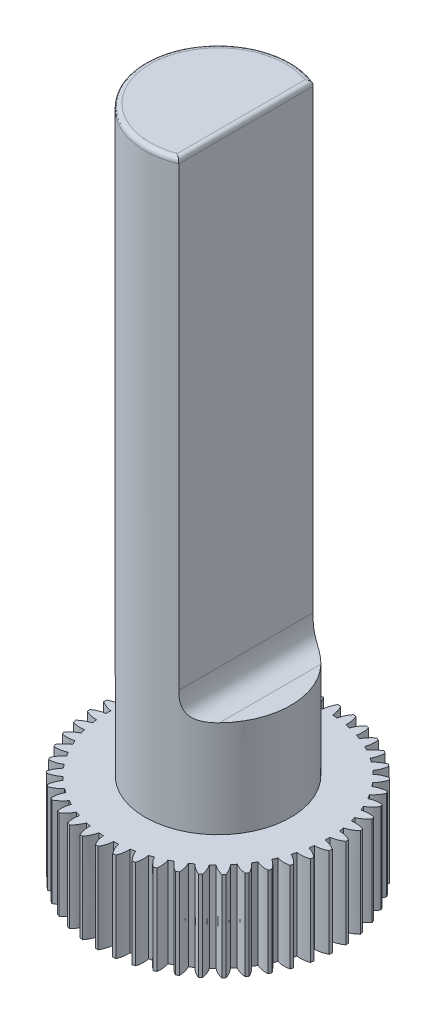
from build123d import *

# Parameters (mm, degrees)
SKETCH1_R           = 1.5
BOSS_EXTRUDE1_DEPTH = 12
CUT_EXTRUDE1_START  = -10
CUT_EXTRUDE1_DEPTH  = 10
FILLET2_SIZE        = 0.5
FILLET3_SIZE        = 0.1
SKETCH3_R           = 2.26
BOSS_EXTRUDE2_DEPTH = 1.85
BOSS_EXTRUDE3_DEPTH = 1.85
SKETCH5_R           = 0.5
CUT_EXTRUDE2_DEPTH  = 1


with BuildPart() as part:
    # Sketch1 → Boss-Extrude1 (new body)
    with BuildSketch(Plane(origin=(0, 0, 0), x_dir=(1, 0, 0), z_dir=(0, 1, 0))):
        with Locations(Location((0, 0, 0), (0, 0, 270))):
            Circle(SKETCH1_R)
    extrude(amount=BOSS_EXTRUDE1_DEPTH)

    # Sketch2 → Cut-Extrude1 (cut)
    with BuildSketch(Plane(origin=(0, 12, 0), x_dir=(1, 0, 0), z_dir=(0, 1, 0)).offset(CUT_EXTRUDE1_START)):
        with BuildLine():
            Line((0.575999132, 1.385), (0.575999132, -1.385))
            ThreePointArc((0.575999132, -1.385), (1.5, 0), (0.575999132, 1.385))
        make_face()
    extrude(amount=CUT_EXTRUDE1_DEPTH, mode=Mode.SUBTRACT)

    # Fillet2
    # a fillet whose section is not a circle: 0.5 mm, written as the material it adds along each edge
    with BuildSketch(Plane(origin=(0.575999132, 2, -2.635), x_dir=(0, 1, 0), z_dir=(0, 0, 1))) as fillet2_piece_1_section:
        with BuildLine():
            add(Edge.make_bspline([(FILLET2_SIZE, 0), (FILLET2_SIZE * 0.831801948466, 0), (FILLET2_SIZE * 0.663603896932, 0), (FILLET2_SIZE * 0.292893218813, -FILLET2_SIZE * 0.0716919198361), (FILLET2_SIZE * 0.0716919198361, -FILLET2_SIZE * 0.292893218813), (0, -FILLET2_SIZE * 0.663603896932), (0, -FILLET2_SIZE * 0.831801948466), (0, -FILLET2_SIZE)], knots=[0, 0, 0, 0, 0, 0, 0.5, 0.5, 1, 1, 1, 1, 1, 1], degree=5))
            Line((0, -FILLET2_SIZE), (-FILLET2_SIZE * 0.02, -FILLET2_SIZE))
            Line((-FILLET2_SIZE * 0.02, -FILLET2_SIZE), (-FILLET2_SIZE * 0.02, FILLET2_SIZE * 0.02))
            Line((-FILLET2_SIZE * 0.02, FILLET2_SIZE * 0.02), (FILLET2_SIZE, FILLET2_SIZE * 0.02))
            Line((FILLET2_SIZE, FILLET2_SIZE * 0.02), (FILLET2_SIZE, 0))
        make_face()
    fillet2_piece_1 = extrude(amount=5.27, mode=Mode.PRIVATE)
    fillet2_piece_1 = fillet2_piece_1 & Plane(origin=(0, 2, 0), x_dir=(0, 0, 1), z_dir=(0, -1, 0)) * Cylinder(1.5, 13, mode=Mode.PRIVATE)
    add(fillet2_piece_1)

    # Fillet3
    # a fillet whose section is not a circle: 0.1 mm, written as the material it takes off along each edge
    with BuildSketch(Plane(origin=(0, 12, 0), x_dir=(0.5321434163094132, 0, -0.8466542295875846), z_dir=(0.8466542295875846, 0, 0.5321434163094132))) as fillet3_piece_1:
        with BuildLine():
            add(Edge.make_bspline([(1.5, -FILLET3_SIZE), (1.5, -FILLET3_SIZE * 0.831801948466), (1.5, -FILLET3_SIZE * 0.663603896932), (1.5 - FILLET3_SIZE * 0.0716919198361, -FILLET3_SIZE * 0.292893218813), (1.5 - FILLET3_SIZE * 0.292893218813, -FILLET3_SIZE * 0.0716919198361), (1.5 - FILLET3_SIZE * 0.663603896932, 0), (1.5 - FILLET3_SIZE * 0.831801948466, 0), (1.5 - FILLET3_SIZE, 0)], knots=[0, 0, 0, 0, 0, 0, 0.5, 0.5, 1, 1, 1, 1, 1, 1], degree=5))
            Line((1.5 - FILLET3_SIZE, 0), (1.5, 0))
            Line((1.5, 0), (1.5, -FILLET3_SIZE))
        make_face()
    revolve(axis=Axis((0, 12, 0), (0, 1, 0)), revolution_arc=212.150391549, mode=Mode.SUBTRACT)
    with BuildSketch(Plane(origin=(0.575999132, 12, -1.635), x_dir=(0, -1, 0), z_dir=(0, 0, 1))) as fillet3_piece_2:
        with BuildLine():
            add(Edge.make_bspline([(FILLET3_SIZE, 0), (FILLET3_SIZE * 0.831801948466, 0), (FILLET3_SIZE * 0.663603896932, 0), (FILLET3_SIZE * 0.292893218813, -FILLET3_SIZE * 0.0716919198361), (FILLET3_SIZE * 0.0716919198361, -FILLET3_SIZE * 0.292893218813), (0, -FILLET3_SIZE * 0.663603896932), (0, -FILLET3_SIZE * 0.831801948466), (0, -FILLET3_SIZE)], knots=[0, 0, 0, 0, 0, 0, 0.5, 0.5, 1, 1, 1, 1, 1, 1], degree=5))
            Line((0, -FILLET3_SIZE), (0, 0))
            Line((0, 0), (FILLET3_SIZE, 0))
        make_face()
    extrude(amount=3.27, mode=Mode.SUBTRACT)
    with BuildSketch(Plane(origin=(0, 12, 0), x_dir=(0, 0, 1), z_dir=(-1, 0, 0))) as fillet3_piece_3:
        with BuildLine():
            add(Edge.make_bspline([(1.5, -FILLET3_SIZE), (1.5, -FILLET3_SIZE * 0.831801948466), (1.5, -FILLET3_SIZE * 0.663603896932), (1.5 - FILLET3_SIZE * 0.0716919198361, -FILLET3_SIZE * 0.292893218813), (1.5 - FILLET3_SIZE * 0.292893218813, -FILLET3_SIZE * 0.0716919198361), (1.5 - FILLET3_SIZE * 0.663603896932, 0), (1.5 - FILLET3_SIZE * 0.831801948466, 0), (1.5 - FILLET3_SIZE, 0)], knots=[0, 0, 0, 0, 0, 0, 0.5, 0.5, 1, 1, 1, 1, 1, 1], degree=5))
            Line((1.5 - FILLET3_SIZE, 0), (1.5, 0))
            Line((1.5, 0), (1.5, -FILLET3_SIZE))
        make_face()
    revolve(axis=Axis((0, 12, 0), (0, 1, 0)), revolution_arc=32.131175169, mode=Mode.SUBTRACT)

    # Sketch3 → Boss-Extrude2 (add)
    with BuildSketch(Plane.XZ):
        with Locations(Location((0, 0, 0), (0, 0, 270))):
            Circle(SKETCH3_R)
    extrude(amount=BOSS_EXTRUDE2_DEPTH)

    # Sketch4 → Boss-Extrude3 (add)
    with BuildSketch(Plane.XZ.offset(1.85)):
        with BuildLine():
            Line((-0.03, 2.5), (0.03, 2.5))
            add(Edge.make_bspline(
                [(0.03, 2.5), (0.099840217, 2.379264551), (0.105, 2.249069746)],
                knots=[0, 0, 0, 0.862405798, 0.862405798, 0.862405798], degree=2))
            Line((0.105, 2.249069746), (0, 2.26))
            Line((0, 2.26), (-0.105, 2.249069746))
            add(Edge.make_bspline(
                [(-0.03, 2.5), (-0.099840217, 2.379264551), (-0.105, 2.249069746)],
                knots=[0, 0, 0, 0.862405798, 0.862405798, 0.862405798], degree=2))
        make_face()
        with BuildLine():
            Line((0.310696044, 2.480799865), (0.370137201, 2.472629866))
            add(Edge.make_bspline(
                [(0.370137201, 2.472629866), (0.422886781, 2.343509044), (0.410270315, 2.213824291)],
                knots=[0, 0, 0, 0.862405798, 0.862405798, 0.862405798], degree=2))
            Line((0.410270315, 2.213824291), (0.307736627, 2.238950238))
            Line((0.307736627, 2.238950238), (0.202226267, 2.242419287))
            add(Edge.make_bspline(
                [(0.310696044, 2.480799865), (0.225066181, 2.37069886), (0.202226267, 2.242419287)],
                knots=[0, 0, 0, 0.862405798, 0.862405798, 0.862405798], degree=2))
        make_face()
        with BuildLine():
            Line((0.645604409, 2.415387122), (0.703379447, 2.399199315))
            add(Edge.make_bspline(
                [(0.703379447, 2.399199315), (0.738055765, 2.264098399), (0.707898071, 2.137339478)],
                knots=[0, 0, 0, 0.862405798, 0.862405798, 0.862405798], degree=2))
            Line((0.707898071, 2.137339478), (0.609740703, 2.176193069))
            Line((0.609740703, 2.176193069), (0.50568544, 2.1939968))
            add(Edge.make_bspline(
                [(0.645604409, 2.415387122), (0.545780022, 2.317971535), (0.50568544, 2.1939968)],
                knots=[0, 0, 0, 0.862405798, 0.862405798, 0.862405798], degree=2))
        make_face()
        with BuildLine():
            Line((0.968486386, 2.304980286), (1.023519064, 2.281076221))
            add(Edge.make_bspline(
                [(1.023519064, 2.281076221), (1.039476166, 2.142511884), (0.992339025, 2.021040074)],
                knots=[0, 0, 0, 0.862405798, 0.862405798, 0.862405798], degree=2))
            Line((0.992339025, 2.021040074), (0.900386463, 2.072897541))
            Line((0.900386463, 2.072897541), (0.799724651, 2.104704303))
            add(Edge.make_bspline(
                [(0.968486386, 2.304980286), (0.856327014, 2.222064787), (0.799724651, 2.104704303)],
                knots=[0, 0, 0, 0.862405798, 0.862405798, 0.862405798], degree=2))
        make_face()
        with BuildLine():
            Line((1.273327293, 2.15163603), (1.324592457, 2.120460993))
            add(Edge.make_bspline(
                [(1.324592457, 2.120460993), (1.321533093, 1.981014426), (1.25829458, 1.867092518)],
                knots=[0, 0, 0, 0.862405798, 0.862405798, 0.862405798], degree=2))
            Line((1.25829458, 1.867092518), (1.174259727, 1.930987854))
            Line((1.174259727, 1.930987854), (1.078866505, 1.976205148))
            add(Edge.make_bspline(
                [(1.273327293, 2.15163603), (1.150922254, 2.084765175), (1.078866505, 1.976205148)],
                knots=[0, 0, 0, 0.862405798, 0.862405798, 0.862405798], degree=2))
        make_face()
        with BuildLine():
            Line((1.554448522, 1.958210865), (1.6009912, 1.920345588))
            add(Edge.make_bspline(
                [(1.6009912, 1.920345588), (1.578972358, 1.782614418), (1.500810488, 1.678364561)],
                knots=[0, 0, 0, 0.862405798, 0.862405798, 0.862405798], degree=2))
            Line((1.500810488, 1.678364561), (1.426258754, 1.753107517))
            Line((1.426258754, 1.753107517), (1.337911117, 1.81089303))
            add(Edge.make_bspline(
                [(1.554448522, 1.958210865), (1.42407799, 1.908630333), (1.337911117, 1.81089303)],
                knots=[0, 0, 0, 0.862405798, 0.862405798, 0.862405798], degree=2))
        make_face()
        with BuildLine():
            Line((1.806613316, 1.728307937), (1.847566505, 1.684457779))
            add(Edge.make_bspline(
                [(1.847566505, 1.684457779), (1.806998356, 1.551007676), (1.715369136, 1.458371848)],
                knots=[0, 0, 0, 0.862405798, 0.862405798, 0.862405798], degree=2))
            Line((1.715369136, 1.458371848), (1.651689279, 1.542570104))
            Line((1.651689279, 1.542570104), (1.572032976, 1.611847401))
            add(Edge.make_bspline(
                [(1.806613316, 1.728307937), (1.670705848, 1.696941319), (1.572032976, 1.611847401)],
                knots=[0, 0, 0, 0.862405798, 0.862405798, 0.862405798], degree=2))
        make_face()
        with BuildLine():
            Line((2.025124323, 1.466209902), (2.059725142, 1.417191708))
            add(Edge.make_bspline(
                [(2.059725142, 1.417191708), (2.001363394, 1.290508596), (1.897973703, 1.211212427)],
                knots=[0, 0, 0, 0.862405798, 0.862405798, 0.862405798], degree=2))
            Line((1.897973703, 1.211212427), (1.846351958, 1.303297528))
            Line((1.846351958, 1.303297528), (1.776870836, 1.382776104))
            add(Edge.make_bspline(
                [(2.025124323, 1.466209902), (1.886211617, 1.453641499), (1.776870836, 1.382776104)],
                knots=[0, 0, 0, 0.862405798, 0.862405798, 0.862405798], degree=2))
        make_face()
        with BuildLine():
            Line((2.205911095, 1.176799151), (2.233514997, 1.123526038))
            add(Edge.make_bspline(
                [(2.233514997, 1.123526038), (2.158446819, 1.005969782), (2.045222611, 0.94149041)],
                knots=[0, 0, 0, 0.862405798, 0.862405798, 0.862405798], degree=2))
            Line((2.045222611, 0.94149041), (2.006620594, 1.039746985))
            Line((2.006620594, 1.039746985), (1.948608954, 1.127946305))
            add(Edge.make_bspline(
                [(2.205911095, 1.176799151), (2.066580832, 1.183263089), (1.948608954, 1.127946305)],
                knots=[0, 0, 0, 0.862405798, 0.862405798, 0.862405798], degree=2))
        make_face()
        with BuildLine():
            Line((2.345605917, 0.865466858), (2.365698694, 0.808931203))
            add(Edge.make_bspline(
                [(2.365698694, 0.808931203), (2.275322463, 0.702691655), (2.154372892, 0.654230207)],
                knots=[0, 0, 0, 0.862405798, 0.862405798, 0.862405798], degree=2))
            Line((2.154372892, 0.654230207), (2.129509684, 0.756827924))
            Line((2.129509684, 0.756827924), (2.084048173, 0.852105001))
            add(Edge.make_bspline(
                [(2.345605917, 0.865466858), (2.208453556, 0.890842725), (2.084048173, 0.852105001)],
                knots=[0, 0, 0, 0.862405798, 0.862405798, 0.862405798], degree=2))
        make_face()
        with BuildLine():
            Line((2.441606539, 0.538012555), (2.4538139, 0.47926751))
            add(Edge.make_bspline(
                [(2.4538139, 0.47926751), (2.349813155, 0.386323711), (2.223391282, 0.354782934)],
                knots=[0, 0, 0, 0.862405798, 0.862405798, 0.862405798], degree=2))
            Line((2.223391282, 0.354782934), (2.212730038, 0.459810589))
            Line((2.212730038, 0.459810589), (2.180665519, 0.560390593))
            add(Edge.make_bspline(
                [(2.441606539, 0.538012555), (2.309186969, 0.581827648), (2.180665519, 0.560390593)],
                knots=[0, 0, 0, 0.862405798, 0.862405798, 0.862405798], degree=2))
        make_face()
        with BuildLine():
            Line((2.492124651, 0.200536096), (2.496219195, 0.14067597))
            add(Edge.make_bspline(
                [(2.496219195, 0.14067597), (2.380531273, 0.062759288), (2.250992099, 0.048726727)],
                knots=[0, 0, 0, 0.862405798, 0.862405798, 0.862405798], degree=2))
            Line((2.250992099, 0.048726727), (2.254731418, 0.154227854))
            Line((2.254731418, 0.154227854), (2.236661192, 0.258237168))
            add(Edge.make_bspline(
                [(2.492124651, 0.200536096), (2.366904599, 0.261974222), (2.236661192, 0.258237168)],
                knots=[0, 0, 0, 0.862405798, 0.862405798, 0.862405798], degree=2))
        make_face()
        with BuildLine():
            Line((2.496219195, -0.14067597), (2.492124651, -0.200536096))
            add(Edge.make_bspline(
                [(2.492124651, -0.200536096), (2.366904599, -0.261974222), (2.236661192, -0.258237168)],
                knots=[0, 0, 0, 0.862405798, 0.862405798, 0.862405798], degree=2))
            Line((2.236661192, -0.258237168), (2.254731418, -0.154227854))
            Line((2.254731418, -0.154227854), (2.250992099, -0.048726727))
            add(Edge.make_bspline(
                [(2.496219195, -0.14067597), (2.380531273, -0.062759288), (2.250992099, -0.048726727)],
                knots=[0, 0, 0, 0.862405798, 0.862405798, 0.862405798], degree=2))
        make_face()
        with BuildLine():
            Line((2.4538139, -0.47926751), (2.441606539, -0.538012555))
            add(Edge.make_bspline(
                [(2.441606539, -0.538012555), (2.309186969, -0.581827648), (2.180665519, -0.560390593)],
                knots=[0, 0, 0, 0.862405798, 0.862405798, 0.862405798], degree=2))
            Line((2.180665519, -0.560390593), (2.212730038, -0.459810589))
            Line((2.212730038, -0.459810589), (2.223391282, -0.354782934))
            add(Edge.make_bspline(
                [(2.4538139, -0.47926751), (2.349813155, -0.386323711), (2.223391282, -0.354782934)],
                knots=[0, 0, 0, 0.862405798, 0.862405798, 0.862405798], degree=2))
        make_face()
        with BuildLine():
            Line((2.365698694, -0.808931203), (2.345605917, -0.865466858))
            add(Edge.make_bspline(
                [(2.345605917, -0.865466858), (2.208453556, -0.890842725), (2.084048173, -0.852105001)],
                knots=[0, 0, 0, 0.862405798, 0.862405798, 0.862405798], degree=2))
            Line((2.084048173, -0.852105001), (2.129509684, -0.756827924))
            Line((2.129509684, -0.756827924), (2.154372892, -0.654230207))
            add(Edge.make_bspline(
                [(2.365698694, -0.808931203), (2.275322463, -0.702691655), (2.154372892, -0.654230207)],
                knots=[0, 0, 0, 0.862405798, 0.862405798, 0.862405798], degree=2))
        make_face()
        with BuildLine():
            Line((2.233514997, -1.123526038), (2.205911095, -1.176799151))
            add(Edge.make_bspline(
                [(2.205911095, -1.176799151), (2.066580832, -1.183263089), (1.948608954, -1.127946305)],
                knots=[0, 0, 0, 0.862405798, 0.862405798, 0.862405798], degree=2))
            Line((1.948608954, -1.127946305), (2.006620594, -1.039746985))
            Line((2.006620594, -1.039746985), (2.045222611, -0.94149041))
            add(Edge.make_bspline(
                [(2.233514997, -1.123526038), (2.158446819, -1.005969782), (2.045222611, -0.94149041)],
                knots=[0, 0, 0, 0.862405798, 0.862405798, 0.862405798], degree=2))
        make_face()
        with BuildLine():
            Line((2.059725142, -1.417191708), (2.025124323, -1.466209902))
            add(Edge.make_bspline(
                [(2.025124323, -1.466209902), (1.886211617, -1.453641499), (1.776870836, -1.382776104)],
                knots=[0, 0, 0, 0.862405798, 0.862405798, 0.862405798], degree=2))
            Line((1.776870836, -1.382776104), (1.846351958, -1.303297528))
            Line((1.846351958, -1.303297528), (1.897973703, -1.211212427))
            add(Edge.make_bspline(
                [(2.059725142, -1.417191708), (2.001363394, -1.290508596), (1.897973703, -1.211212427)],
                knots=[0, 0, 0, 0.862405798, 0.862405798, 0.862405798], degree=2))
        make_face()
        with BuildLine():
            Line((1.847566505, -1.684457779), (1.806613316, -1.728307937))
            add(Edge.make_bspline(
                [(1.806613316, -1.728307937), (1.670705848, -1.696941319), (1.572032976, -1.611847401)],
                knots=[0, 0, 0, 0.862405798, 0.862405798, 0.862405798], degree=2))
            Line((1.572032976, -1.611847401), (1.651689279, -1.542570104))
            Line((1.651689279, -1.542570104), (1.715369136, -1.458371848))
            add(Edge.make_bspline(
                [(1.847566505, -1.684457779), (1.806998356, -1.551007676), (1.715369136, -1.458371848)],
                knots=[0, 0, 0, 0.862405798, 0.862405798, 0.862405798], degree=2))
        make_face()
        with BuildLine():
            Line((1.6009912, -1.920345588), (1.554448522, -1.958210865))
            add(Edge.make_bspline(
                [(1.554448522, -1.958210865), (1.42407799, -1.908630333), (1.337911117, -1.81089303)],
                knots=[0, 0, 0, 0.862405798, 0.862405798, 0.862405798], degree=2))
            Line((1.337911117, -1.81089303), (1.426258754, -1.753107517))
            Line((1.426258754, -1.753107517), (1.500810488, -1.678364561))
            add(Edge.make_bspline(
                [(1.6009912, -1.920345588), (1.578972358, -1.782614418), (1.500810488, -1.678364561)],
                knots=[0, 0, 0, 0.862405798, 0.862405798, 0.862405798], degree=2))
        make_face()
        with BuildLine():
            Line((1.324592457, -2.120460993), (1.273327293, -2.15163603))
            add(Edge.make_bspline(
                [(1.273327293, -2.15163603), (1.150922254, -2.084765175), (1.078866505, -1.976205148)],
                knots=[0, 0, 0, 0.862405798, 0.862405798, 0.862405798], degree=2))
            Line((1.078866505, -1.976205148), (1.174259727, -1.930987854))
            Line((1.174259727, -1.930987854), (1.25829458, -1.867092518))
            add(Edge.make_bspline(
                [(1.324592457, -2.120460993), (1.321533093, -1.981014426), (1.25829458, -1.867092518)],
                knots=[0, 0, 0, 0.862405798, 0.862405798, 0.862405798], degree=2))
        make_face()
        with BuildLine():
            Line((1.023519064, -2.281076221), (0.968486386, -2.304980286))
            add(Edge.make_bspline(
                [(0.968486386, -2.304980286), (0.856327014, -2.222064787), (0.799724651, -2.104704303)],
                knots=[0, 0, 0, 0.862405798, 0.862405798, 0.862405798], degree=2))
            Line((0.799724651, -2.104704303), (0.900386463, -2.072897541))
            Line((0.900386463, -2.072897541), (0.992339025, -2.021040074))
            add(Edge.make_bspline(
                [(1.023519064, -2.281076221), (1.039476166, -2.142511884), (0.992339025, -2.021040074)],
                knots=[0, 0, 0, 0.862405798, 0.862405798, 0.862405798], degree=2))
        make_face()
        with BuildLine():
            Line((0.703379447, -2.399199315), (0.645604409, -2.415387122))
            add(Edge.make_bspline(
                [(0.645604409, -2.415387122), (0.545780022, -2.317971535), (0.50568544, -2.1939968)],
                knots=[0, 0, 0, 0.862405798, 0.862405798, 0.862405798], degree=2))
            Line((0.50568544, -2.1939968), (0.609740703, -2.176193069))
            Line((0.609740703, -2.176193069), (0.707898071, -2.137339478))
            add(Edge.make_bspline(
                [(0.703379447, -2.399199315), (0.738055765, -2.264098399), (0.707898071, -2.137339478)],
                knots=[0, 0, 0, 0.862405798, 0.862405798, 0.862405798], degree=2))
        make_face()
        with BuildLine():
            Line((0.370137201, -2.472629866), (0.310696044, -2.480799865))
            add(Edge.make_bspline(
                [(0.310696044, -2.480799865), (0.225066181, -2.37069886), (0.202226267, -2.242419287)],
                knots=[0, 0, 0, 0.862405798, 0.862405798, 0.862405798], degree=2))
            Line((0.202226267, -2.242419287), (0.307736627, -2.238950238))
            Line((0.307736627, -2.238950238), (0.410270315, -2.213824291))
            add(Edge.make_bspline(
                [(0.370137201, -2.472629866), (0.422886781, -2.343509044), (0.410270315, -2.213824291)],
                knots=[0, 0, 0, 0.862405798, 0.862405798, 0.862405798], degree=2))
        make_face()
        with BuildLine():
            Line((0.03, -2.5), (-0.03, -2.5))
            add(Edge.make_bspline(
                [(-0.03, -2.5), (-0.099840217, -2.379264551), (-0.105, -2.249069746)],
                knots=[0, 0, 0, 0.862405798, 0.862405798, 0.862405798], degree=2))
            Line((-0.105, -2.249069746), (0, -2.26))
            Line((0, -2.26), (0.105, -2.249069746))
            add(Edge.make_bspline(
                [(0.03, -2.5), (0.099840217, -2.379264551), (0.105, -2.249069746)],
                knots=[0, 0, 0, 0.862405798, 0.862405798, 0.862405798], degree=2))
        make_face()
        with BuildLine():
            Line((-0.310696044, -2.480799865), (-0.370137201, -2.472629866))
            add(Edge.make_bspline(
                [(-0.370137201, -2.472629866), (-0.422886781, -2.343509044), (-0.410270315, -2.213824291)],
                knots=[0, 0, 0, 0.862405798, 0.862405798, 0.862405798], degree=2))
            Line((-0.410270315, -2.213824291), (-0.307736627, -2.238950238))
            Line((-0.307736627, -2.238950238), (-0.202226267, -2.242419287))
            add(Edge.make_bspline(
                [(-0.310696044, -2.480799865), (-0.225066181, -2.37069886), (-0.202226267, -2.242419287)],
                knots=[0, 0, 0, 0.862405798, 0.862405798, 0.862405798], degree=2))
        make_face()
        with BuildLine():
            Line((-0.645604409, -2.415387122), (-0.703379447, -2.399199315))
            add(Edge.make_bspline(
                [(-0.703379447, -2.399199315), (-0.738055765, -2.264098399), (-0.707898071, -2.137339478)],
                knots=[0, 0, 0, 0.862405798, 0.862405798, 0.862405798], degree=2))
            Line((-0.707898071, -2.137339478), (-0.609740703, -2.176193069))
            Line((-0.609740703, -2.176193069), (-0.50568544, -2.1939968))
            add(Edge.make_bspline(
                [(-0.645604409, -2.415387122), (-0.545780022, -2.317971535), (-0.50568544, -2.1939968)],
                knots=[0, 0, 0, 0.862405798, 0.862405798, 0.862405798], degree=2))
        make_face()
        with BuildLine():
            Line((-0.968486386, -2.304980286), (-1.023519064, -2.281076221))
            add(Edge.make_bspline(
                [(-1.023519064, -2.281076221), (-1.039476166, -2.142511884), (-0.992339025, -2.021040074)],
                knots=[0, 0, 0, 0.862405798, 0.862405798, 0.862405798], degree=2))
            Line((-0.992339025, -2.021040074), (-0.900386463, -2.072897541))
            Line((-0.900386463, -2.072897541), (-0.799724651, -2.104704303))
            add(Edge.make_bspline(
                [(-0.968486386, -2.304980286), (-0.856327014, -2.222064787), (-0.799724651, -2.104704303)],
                knots=[0, 0, 0, 0.862405798, 0.862405798, 0.862405798], degree=2))
        make_face()
        with BuildLine():
            Line((-1.273327293, -2.15163603), (-1.324592457, -2.120460993))
            add(Edge.make_bspline(
                [(-1.324592457, -2.120460993), (-1.321533093, -1.981014426), (-1.25829458, -1.867092518)],
                knots=[0, 0, 0, 0.862405798, 0.862405798, 0.862405798], degree=2))
            Line((-1.25829458, -1.867092518), (-1.174259727, -1.930987854))
            Line((-1.174259727, -1.930987854), (-1.078866505, -1.976205148))
            add(Edge.make_bspline(
                [(-1.273327293, -2.15163603), (-1.150922254, -2.084765175), (-1.078866505, -1.976205148)],
                knots=[0, 0, 0, 0.862405798, 0.862405798, 0.862405798], degree=2))
        make_face()
        with BuildLine():
            Line((-1.554448522, -1.958210865), (-1.6009912, -1.920345588))
            add(Edge.make_bspline(
                [(-1.6009912, -1.920345588), (-1.578972358, -1.782614418), (-1.500810488, -1.678364561)],
                knots=[0, 0, 0, 0.862405798, 0.862405798, 0.862405798], degree=2))
            Line((-1.500810488, -1.678364561), (-1.426258754, -1.753107517))
            Line((-1.426258754, -1.753107517), (-1.337911117, -1.81089303))
            add(Edge.make_bspline(
                [(-1.554448522, -1.958210865), (-1.42407799, -1.908630333), (-1.337911117, -1.81089303)],
                knots=[0, 0, 0, 0.862405798, 0.862405798, 0.862405798], degree=2))
        make_face()
        with BuildLine():
            Line((-1.806613316, -1.728307937), (-1.847566505, -1.684457779))
            add(Edge.make_bspline(
                [(-1.847566505, -1.684457779), (-1.806998356, -1.551007676), (-1.715369136, -1.458371848)],
                knots=[0, 0, 0, 0.862405798, 0.862405798, 0.862405798], degree=2))
            Line((-1.715369136, -1.458371848), (-1.651689279, -1.542570104))
            Line((-1.651689279, -1.542570104), (-1.572032976, -1.611847401))
            add(Edge.make_bspline(
                [(-1.806613316, -1.728307937), (-1.670705848, -1.696941319), (-1.572032976, -1.611847401)],
                knots=[0, 0, 0, 0.862405798, 0.862405798, 0.862405798], degree=2))
        make_face()
        with BuildLine():
            Line((-2.025124323, -1.466209902), (-2.059725142, -1.417191708))
            add(Edge.make_bspline(
                [(-2.059725142, -1.417191708), (-2.001363394, -1.290508596), (-1.897973703, -1.211212427)],
                knots=[0, 0, 0, 0.862405798, 0.862405798, 0.862405798], degree=2))
            Line((-1.897973703, -1.211212427), (-1.846351958, -1.303297528))
            Line((-1.846351958, -1.303297528), (-1.776870836, -1.382776104))
            add(Edge.make_bspline(
                [(-2.025124323, -1.466209902), (-1.886211617, -1.453641499), (-1.776870836, -1.382776104)],
                knots=[0, 0, 0, 0.862405798, 0.862405798, 0.862405798], degree=2))
        make_face()
        with BuildLine():
            Line((-2.205911095, -1.176799151), (-2.233514997, -1.123526038))
            add(Edge.make_bspline(
                [(-2.233514997, -1.123526038), (-2.158446819, -1.005969782), (-2.045222611, -0.94149041)],
                knots=[0, 0, 0, 0.862405798, 0.862405798, 0.862405798], degree=2))
            Line((-2.045222611, -0.94149041), (-2.006620594, -1.039746985))
            Line((-2.006620594, -1.039746985), (-1.948608954, -1.127946305))
            add(Edge.make_bspline(
                [(-2.205911095, -1.176799151), (-2.066580832, -1.183263089), (-1.948608954, -1.127946305)],
                knots=[0, 0, 0, 0.862405798, 0.862405798, 0.862405798], degree=2))
        make_face()
        with BuildLine():
            Line((-2.345605917, -0.865466858), (-2.365698694, -0.808931203))
            add(Edge.make_bspline(
                [(-2.365698694, -0.808931203), (-2.275322463, -0.702691655), (-2.154372892, -0.654230207)],
                knots=[0, 0, 0, 0.862405798, 0.862405798, 0.862405798], degree=2))
            Line((-2.154372892, -0.654230207), (-2.129509684, -0.756827924))
            Line((-2.129509684, -0.756827924), (-2.084048173, -0.852105001))
            add(Edge.make_bspline(
                [(-2.345605917, -0.865466858), (-2.208453556, -0.890842725), (-2.084048173, -0.852105001)],
                knots=[0, 0, 0, 0.862405798, 0.862405798, 0.862405798], degree=2))
        make_face()
        with BuildLine():
            Line((-2.441606539, -0.538012555), (-2.4538139, -0.47926751))
            add(Edge.make_bspline(
                [(-2.4538139, -0.47926751), (-2.349813155, -0.386323711), (-2.223391282, -0.354782934)],
                knots=[0, 0, 0, 0.862405798, 0.862405798, 0.862405798], degree=2))
            Line((-2.223391282, -0.354782934), (-2.212730038, -0.459810589))
            Line((-2.212730038, -0.459810589), (-2.180665519, -0.560390593))
            add(Edge.make_bspline(
                [(-2.441606539, -0.538012555), (-2.309186969, -0.581827648), (-2.180665519, -0.560390593)],
                knots=[0, 0, 0, 0.862405798, 0.862405798, 0.862405798], degree=2))
        make_face()
        with BuildLine():
            Line((-2.492124651, -0.200536096), (-2.496219195, -0.14067597))
            add(Edge.make_bspline(
                [(-2.496219195, -0.14067597), (-2.380531273, -0.062759288), (-2.250992099, -0.048726727)],
                knots=[0, 0, 0, 0.862405798, 0.862405798, 0.862405798], degree=2))
            Line((-2.250992099, -0.048726727), (-2.254731418, -0.154227854))
            Line((-2.254731418, -0.154227854), (-2.236661192, -0.258237168))
            add(Edge.make_bspline(
                [(-2.492124651, -0.200536096), (-2.366904599, -0.261974222), (-2.236661192, -0.258237168)],
                knots=[0, 0, 0, 0.862405798, 0.862405798, 0.862405798], degree=2))
        make_face()
        with BuildLine():
            Line((-2.496219195, 0.14067597), (-2.492124651, 0.200536096))
            add(Edge.make_bspline(
                [(-2.492124651, 0.200536096), (-2.366904599, 0.261974222), (-2.236661192, 0.258237168)],
                knots=[0, 0, 0, 0.862405798, 0.862405798, 0.862405798], degree=2))
            Line((-2.236661192, 0.258237168), (-2.254731418, 0.154227854))
            Line((-2.254731418, 0.154227854), (-2.250992099, 0.048726727))
            add(Edge.make_bspline(
                [(-2.496219195, 0.14067597), (-2.380531273, 0.062759288), (-2.250992099, 0.048726727)],
                knots=[0, 0, 0, 0.862405798, 0.862405798, 0.862405798], degree=2))
        make_face()
        with BuildLine():
            Line((-2.4538139, 0.47926751), (-2.441606539, 0.538012555))
            add(Edge.make_bspline(
                [(-2.441606539, 0.538012555), (-2.309186969, 0.581827648), (-2.180665519, 0.560390593)],
                knots=[0, 0, 0, 0.862405798, 0.862405798, 0.862405798], degree=2))
            Line((-2.180665519, 0.560390593), (-2.212730038, 0.459810589))
            Line((-2.212730038, 0.459810589), (-2.223391282, 0.354782934))
            add(Edge.make_bspline(
                [(-2.4538139, 0.47926751), (-2.349813155, 0.386323711), (-2.223391282, 0.354782934)],
                knots=[0, 0, 0, 0.862405798, 0.862405798, 0.862405798], degree=2))
        make_face()
        with BuildLine():
            Line((-2.365698694, 0.808931203), (-2.345605917, 0.865466858))
            add(Edge.make_bspline(
                [(-2.345605917, 0.865466858), (-2.208453556, 0.890842725), (-2.084048173, 0.852105001)],
                knots=[0, 0, 0, 0.862405798, 0.862405798, 0.862405798], degree=2))
            Line((-2.084048173, 0.852105001), (-2.129509684, 0.756827924))
            Line((-2.129509684, 0.756827924), (-2.154372892, 0.654230207))
            add(Edge.make_bspline(
                [(-2.365698694, 0.808931203), (-2.275322463, 0.702691655), (-2.154372892, 0.654230207)],
                knots=[0, 0, 0, 0.862405798, 0.862405798, 0.862405798], degree=2))
        make_face()
        with BuildLine():
            Line((-2.233514997, 1.123526038), (-2.205911095, 1.176799151))
            add(Edge.make_bspline(
                [(-2.205911095, 1.176799151), (-2.066580832, 1.183263089), (-1.948608954, 1.127946305)],
                knots=[0, 0, 0, 0.862405798, 0.862405798, 0.862405798], degree=2))
            Line((-1.948608954, 1.127946305), (-2.006620594, 1.039746985))
            Line((-2.006620594, 1.039746985), (-2.045222611, 0.94149041))
            add(Edge.make_bspline(
                [(-2.233514997, 1.123526038), (-2.158446819, 1.005969782), (-2.045222611, 0.94149041)],
                knots=[0, 0, 0, 0.862405798, 0.862405798, 0.862405798], degree=2))
        make_face()
        with BuildLine():
            Line((-2.059725142, 1.417191708), (-2.025124323, 1.466209902))
            add(Edge.make_bspline(
                [(-2.025124323, 1.466209902), (-1.886211617, 1.453641499), (-1.776870836, 1.382776104)],
                knots=[0, 0, 0, 0.862405798, 0.862405798, 0.862405798], degree=2))
            Line((-1.776870836, 1.382776104), (-1.846351958, 1.303297528))
            Line((-1.846351958, 1.303297528), (-1.897973703, 1.211212427))
            add(Edge.make_bspline(
                [(-2.059725142, 1.417191708), (-2.001363394, 1.290508596), (-1.897973703, 1.211212427)],
                knots=[0, 0, 0, 0.862405798, 0.862405798, 0.862405798], degree=2))
        make_face()
        with BuildLine():
            Line((-1.847566505, 1.684457779), (-1.806613316, 1.728307937))
            add(Edge.make_bspline(
                [(-1.806613316, 1.728307937), (-1.670705848, 1.696941319), (-1.572032976, 1.611847401)],
                knots=[0, 0, 0, 0.862405798, 0.862405798, 0.862405798], degree=2))
            Line((-1.572032976, 1.611847401), (-1.651689279, 1.542570104))
            Line((-1.651689279, 1.542570104), (-1.715369136, 1.458371848))
            add(Edge.make_bspline(
                [(-1.847566505, 1.684457779), (-1.806998356, 1.551007676), (-1.715369136, 1.458371848)],
                knots=[0, 0, 0, 0.862405798, 0.862405798, 0.862405798], degree=2))
        make_face()
        with BuildLine():
            Line((-1.6009912, 1.920345588), (-1.554448522, 1.958210865))
            add(Edge.make_bspline(
                [(-1.554448522, 1.958210865), (-1.42407799, 1.908630333), (-1.337911117, 1.81089303)],
                knots=[0, 0, 0, 0.862405798, 0.862405798, 0.862405798], degree=2))
            Line((-1.337911117, 1.81089303), (-1.426258754, 1.753107517))
            Line((-1.426258754, 1.753107517), (-1.500810488, 1.678364561))
            add(Edge.make_bspline(
                [(-1.6009912, 1.920345588), (-1.578972358, 1.782614418), (-1.500810488, 1.678364561)],
                knots=[0, 0, 0, 0.862405798, 0.862405798, 0.862405798], degree=2))
        make_face()
        with BuildLine():
            Line((-1.324592457, 2.120460993), (-1.273327293, 2.15163603))
            add(Edge.make_bspline(
                [(-1.273327293, 2.15163603), (-1.150922254, 2.084765175), (-1.078866505, 1.976205148)],
                knots=[0, 0, 0, 0.862405798, 0.862405798, 0.862405798], degree=2))
            Line((-1.078866505, 1.976205148), (-1.174259727, 1.930987854))
            Line((-1.174259727, 1.930987854), (-1.25829458, 1.867092518))
            add(Edge.make_bspline(
                [(-1.324592457, 2.120460993), (-1.321533093, 1.981014426), (-1.25829458, 1.867092518)],
                knots=[0, 0, 0, 0.862405798, 0.862405798, 0.862405798], degree=2))
        make_face()
        with BuildLine():
            Line((-1.023519064, 2.281076221), (-0.968486386, 2.304980286))
            add(Edge.make_bspline(
                [(-0.968486386, 2.304980286), (-0.856327014, 2.222064787), (-0.799724651, 2.104704303)],
                knots=[0, 0, 0, 0.862405798, 0.862405798, 0.862405798], degree=2))
            Line((-0.799724651, 2.104704303), (-0.900386463, 2.072897541))
            Line((-0.900386463, 2.072897541), (-0.992339025, 2.021040074))
            add(Edge.make_bspline(
                [(-1.023519064, 2.281076221), (-1.039476166, 2.142511884), (-0.992339025, 2.021040074)],
                knots=[0, 0, 0, 0.862405798, 0.862405798, 0.862405798], degree=2))
        make_face()
        with BuildLine():
            Line((-0.703379447, 2.399199315), (-0.645604409, 2.415387122))
            add(Edge.make_bspline(
                [(-0.645604409, 2.415387122), (-0.545780022, 2.317971535), (-0.50568544, 2.1939968)],
                knots=[0, 0, 0, 0.862405798, 0.862405798, 0.862405798], degree=2))
            Line((-0.50568544, 2.1939968), (-0.609740703, 2.176193069))
            Line((-0.609740703, 2.176193069), (-0.707898071, 2.137339478))
            add(Edge.make_bspline(
                [(-0.703379447, 2.399199315), (-0.738055765, 2.264098399), (-0.707898071, 2.137339478)],
                knots=[0, 0, 0, 0.862405798, 0.862405798, 0.862405798], degree=2))
        make_face()
        with BuildLine():
            Line((-0.370137201, 2.472629866), (-0.310696044, 2.480799865))
            add(Edge.make_bspline(
                [(-0.310696044, 2.480799865), (-0.225066181, 2.37069886), (-0.202226267, 2.242419287)],
                knots=[0, 0, 0, 0.862405798, 0.862405798, 0.862405798], degree=2))
            Line((-0.202226267, 2.242419287), (-0.307736627, 2.238950238))
            Line((-0.307736627, 2.238950238), (-0.410270315, 2.213824291))
            add(Edge.make_bspline(
                [(-0.370137201, 2.472629866), (-0.422886781, 2.343509044), (-0.410270315, 2.213824291)],
                knots=[0, 0, 0, 0.862405798, 0.862405798, 0.862405798], degree=2))
        make_face()
    extrude(amount=-BOSS_EXTRUDE3_DEPTH)

    # Sketch5 → Cut-Extrude2 (cut)
    with BuildSketch(Plane.XZ.offset(1.85)):
        with Locations(Location((0, 0, 0), (0, 0, 270))):
            Circle(SKETCH5_R)
    extrude(amount=-CUT_EXTRUDE2_DEPTH, mode=Mode.SUBTRACT)


solid = part.part
